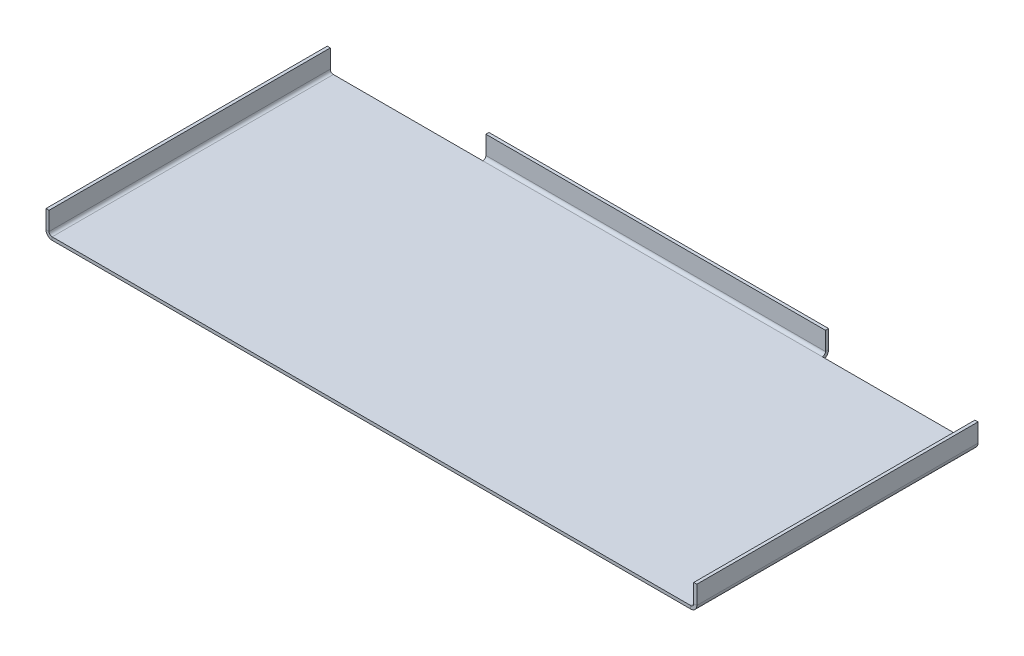
from build123d import *

# Parameters (mm, degrees)
SKETCH1_W                      = 673.11016
SKETCH1_H                      = 290.83
BASE_FLANGE1_DEPTH             = 3.175
EDGE_FLANGE1_DEPTH             = 351.248800168
EDGE_FLANGE2_STRIP_W           = 19.05
EDGE_FLANGE2_STRIP_H           = 3.175
EDGE_FLANGE2_STRIP_CUT_DEPTH   = 290.83
EDGE_FLANGE2_STRIP_2_W         = 19.05
EDGE_FLANGE2_STRIP_2_H         = 3.175
EDGE_FLANGE2_STRIP_CUT_2_DEPTH = 290.83
EDGE_FLANGE2_DEPTH             = 290.83
EDGE_FLANGE2_BEND_DEPTH        = 290.83


# Sheet-metal steps are written as plain solids
with BuildPart() as part:
    # Sketch1 → Base-Flange1 (new body)
    with BuildSketch(Plane(origin=(0, 0, 0), x_dir=(1, 0, 0), z_dir=(0, 1, 0))):
        with Locations((336.55508, 145.415)):
            Rectangle(SKETCH1_W, SKETCH1_H)
    extrude(amount=-BASE_FLANGE1_DEPTH)

    # Edge-Flange1 section (across the edge) → Edge-Flange1 (add)
    with BuildSketch(Plane(origin=(512.179480084, 0, -294.005), x_dir=(0, 0, 1), z_dir=(-1, 0, 0))):
        with BuildLine():
            Line((-3.175, 3.175), (-3.175, 22.225))
            Line((-3.175, 22.225), (0, 22.225))
            Line((0, 22.225), (0, 3.175))
            ThreePointArc((0, 3.175), (0.92993597, 0.92993597), (3.175, 0))
            Line((3.175, 0), (3.175, -3.175))
            ThreePointArc((3.175, -3.175), (-1.315128061, -1.315128061), (-3.175, 3.175))
        make_face()
    extrude(amount=EDGE_FLANGE1_DEPTH)

    # Edge-Flange2 strip (across the edge) → Edge-Flange2 strip cut (cut)
    with BuildSketch(Plane(origin=(673.11016, 0, 0), x_dir=(-1, 0, 0), z_dir=(0, 0, -1))):
        with Locations((-3.175, -1.5875)):
            Rectangle(EDGE_FLANGE2_STRIP_W, EDGE_FLANGE2_STRIP_H)
    extrude(amount=EDGE_FLANGE2_STRIP_CUT_DEPTH, mode=Mode.SUBTRACT)

    # Edge-Flange2 strip 2 (across the edge) → Edge-Flange2 strip cut 2 (cut)
    with BuildSketch(Plane.XY.offset(-290.83)):
        with Locations((-3.175, -1.5875)):
            Rectangle(EDGE_FLANGE2_STRIP_2_W, EDGE_FLANGE2_STRIP_2_H)
    extrude(amount=EDGE_FLANGE2_STRIP_CUT_2_DEPTH, mode=Mode.SUBTRACT)

    # Edge-Flange2 section (across the edge) → Edge-Flange2 (add)
    with BuildSketch(Plane(origin=(673.11016, 0, 0), x_dir=(-1, 0, 0), z_dir=(0, 0, -1))):
        with BuildLine():
            Line((0, 3.175), (0, 22.225))
            Line((0, 22.225), (3.175, 22.225))
            Line((3.175, 22.225), (3.175, 3.175))
            ThreePointArc((3.175, 3.175), (4.10493597, 0.92993597), (6.35, 0))
            Line((6.35, 0), (6.35, -3.175))
            ThreePointArc((6.35, -3.175), (1.859871939, -1.315128061), (0, 3.175))
        make_face()
    extrude(amount=EDGE_FLANGE2_DEPTH)

    # Edge-Flange2 section 2 (across the edge) → Edge-Flange2 bend (add)
    with BuildSketch(Plane.XY.offset(-290.83)):
        with BuildLine():
            Line((0, 3.175), (0, 22.225))
            Line((0, 22.225), (3.175, 22.225))
            Line((3.175, 22.225), (3.175, 3.175))
            ThreePointArc((3.175, 3.175), (4.10493597, 0.92993597), (6.35, 0))
            Line((6.35, 0), (6.35, -3.175))
            ThreePointArc((6.35, -3.175), (1.859871939, -1.315128061), (0, 3.175))
        make_face()
    extrude(amount=EDGE_FLANGE2_BEND_DEPTH)


solid = part.part
